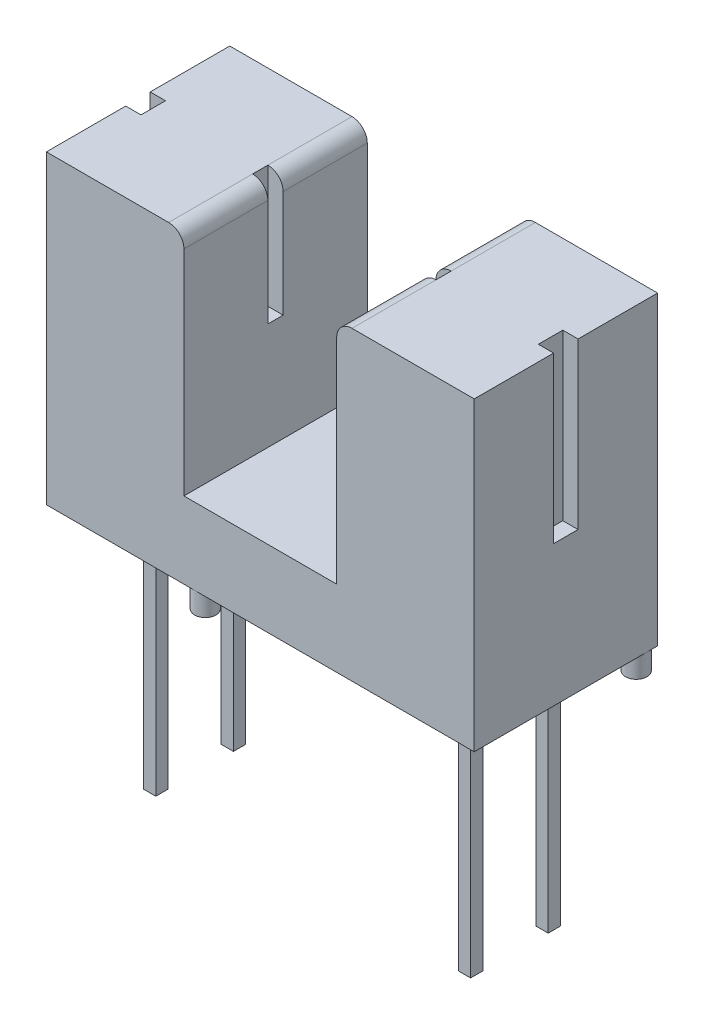
from build123d import *

# Parameters (mm, degrees)
EXTRUDE_1_DEPTH     = 6
FILLET_1_R          = 0.5
SKETCH_2_W          = 0.4
SKETCH_2_H          = 0.4
EXTRUDE_2_DEPTH     = 8
SKETCH_3_W          = 0.8
SKETCH_3_H          = 5.4
CUT_EXTRUDE_1_DEPTH = 0.5
SKETCH_4_W          = 0.8
SKETCH_4_H          = 5.4
CUT_EXTRUDE_2_DEPTH = 0.5
SKETCH_5_W          = 0.5
SKETCH_5_H          = 4
CUT_EXTRUDE_3_DEPTH = 0.5
SKETCH_6_W          = 0.5
SKETCH_6_H          = 4
CUT_EXTRUDE_4_DEPTH = 0.5
SKETCH_7_R          = 0.35
EXTRUDE_3_DEPTH     = 0.7


with BuildPart() as part:
    # 草图1 → 凸台-拉伸1 (new body)
    with BuildSketch(Plane.XY):
        Polygon((-7, 5), (-2.5, 5), (-2.5, -2.5), (2.5, -2.5), (2.5, 5), (7, 5), (7, -5), (-7, -5), align=None)
    extrude(amount=EXTRUDE_1_DEPTH)

    # 圆角1
    fillet_1_edges = [part.edges().sort_by_distance(p)[0] for p in [
        (2.5, 5, 3),
        (-2.5, 5, 3),
    ]]
    fillet(fillet_1_edges, radius=FILLET_1_R)

    # 草图2 → 凸台-拉伸2 (add)
    with BuildSketch(Plane.XZ.offset(5)):
        with Locations((-5.15, 4.27)):
            Rectangle(SKETCH_2_W, SKETCH_2_H)
        with Locations((5.15, 4.27)):
            Rectangle(SKETCH_2_W, SKETCH_2_H)
        with Locations((-5.15, 1.73)):
            Rectangle(SKETCH_2_W, SKETCH_2_H)
        with Locations((5.15, 1.73)):
            Rectangle(SKETCH_2_W, SKETCH_2_H)
    extrude(amount=EXTRUDE_2_DEPTH)

    # 草图3 → 切除-拉伸1 (cut)
    with BuildSketch(Plane.ZY.offset(7)):
        with Locations((3.003385533, 2.3)):
            Rectangle(SKETCH_3_W, SKETCH_3_H)
    extrude(amount=-CUT_EXTRUDE_1_DEPTH, mode=Mode.SUBTRACT)

    # 草图4 → 切除-拉伸2 (cut)
    with BuildSketch(Plane(origin=(7, 0, 0), x_dir=(0, 0, -1), z_dir=(1, 0, 0))):
        with Locations((-3.003385533, 2.3)):
            Rectangle(SKETCH_4_W, SKETCH_4_H)
    extrude(amount=-CUT_EXTRUDE_2_DEPTH, mode=Mode.SUBTRACT)

    # 草图5 → 切除-拉伸3 (cut)
    with BuildSketch(Plane(origin=(-2.5, 0, 0), x_dir=(0, 0, -1), z_dir=(1, 0, 0))):
        with Locations((-3.003385533, 3)):
            Rectangle(SKETCH_5_W, SKETCH_5_H)
    extrude(amount=-CUT_EXTRUDE_3_DEPTH, mode=Mode.SUBTRACT)

    # 草图6 → 切除-拉伸4 (cut)
    with BuildSketch(Plane.ZY.offset(-2.5)):
        with Locations((3.003385533, 3)):
            Rectangle(SKETCH_6_W, SKETCH_6_H)
    extrude(amount=-CUT_EXTRUDE_4_DEPTH, mode=Mode.SUBTRACT)

    # 草图7 → 凸台-拉伸3 (add)
    with BuildSketch(Plane.XZ.offset(5)):
        with Locations((-2.15, 5.65)):
            Circle(SKETCH_7_R)
        with Locations((6.65, 0.35)):
            Circle(SKETCH_7_R)
    extrude(amount=EXTRUDE_3_DEPTH)


solid = part.part
